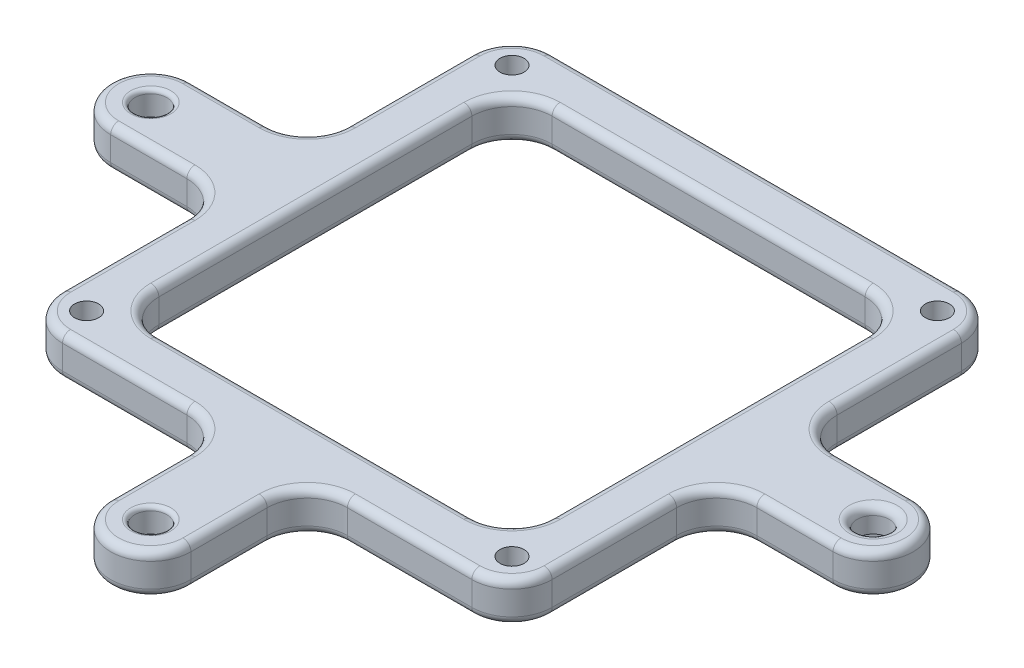
from build123d import *

# Parameters (mm, degrees)
SKETCH1_R           = 2
SKETCH1_R_2         = 1.5
SKETCH1_W           = 49
SKETCH1_H           = 49
BOSS_EXTRUDE1_DEPTH = 5
FILLET1_R           = 5
FILLET2_R           = 5
FILLET3_R           = 5
FILLET4_R           = 1
FILLET5_R           = 0.5
CUT_EXTRUDE1_DEPTH  = 2
FILLET6_R           = 1
CHAMFER2_SIZE       = 0.8


with BuildPart() as part:
    # Sketch1 → Boss-Extrude1 (new body)
    with BuildSketch(Plane(origin=(0, 0, 0), x_dir=(1, 0, 0), z_dir=(0, 1, 0))):
        with BuildLine():
            Line((-30.5, 5), (-45, 5))
            ThreePointArc((-45, 5), (-50, 0), (-45, -5))
            Line((-45, -5), (-30.5, -5))
            Line((-30.5, -5), (-30.5, -30.5))
            Line((-30.5, -30.5), (-5, -30.5))
            Line((-5, -30.5), (-5, -45))
            ThreePointArc((-5, -45), (0, -50), (5, -45))
            Line((5, -45), (5, -30.5))
            Line((5, -30.5), (30.5, -30.5))
            Line((30.5, -30.5), (30.5, -5))
            Line((30.5, -5), (45, -5))
            ThreePointArc((45, -5), (50, 0), (45, 5))
            Line((45, 5), (30.5, 5))
            Line((30.5, 5), (30.5, 30.5))
            Line((30.5, 30.5), (-30.5, 30.5))
            Line((-30.5, 30.5), (-30.5, 5))
        make_face()
        with Locations(Location((-45, 0, 0), (0, 0, 270))):
            Circle(SKETCH1_R, mode=Mode.SUBTRACT)
        with Locations(Location((45, 0, 0), (0, 0, 270))):
            Circle(SKETCH1_R, mode=Mode.SUBTRACT)
        with Locations(Location((0, -45, 0), (0, 0, 270))):
            Circle(SKETCH1_R, mode=Mode.SUBTRACT)
        with Locations(Location((26.5, 26.5, 0), (0, 0, 270))):
            Circle(SKETCH1_R_2, mode=Mode.SUBTRACT)
        with Locations(Location((-26.5, 26.5, 0), (0, 0, 270))):
            Circle(SKETCH1_R_2, mode=Mode.SUBTRACT)
        with Locations(Location((-26.5, -26.5, 0), (0, 0, 270))):
            Circle(SKETCH1_R_2, mode=Mode.SUBTRACT)
        with Locations(Location((26.5, -26.5, 0), (0, 0, 270))):
            Circle(SKETCH1_R_2, mode=Mode.SUBTRACT)
        Rectangle(SKETCH1_W, SKETCH1_H, mode=Mode.SUBTRACT)
    extrude(amount=BOSS_EXTRUDE1_DEPTH)

    # Fillet1
    fillet1_edges = [part.edges().sort_by_distance(p)[0] for p in [
        (24.5, 2.5, -24.5),
        (-24.5, 2.5, -24.5),
        (-24.5, 2.5, 24.5),
        (24.5, 2.5, 24.5),
    ]]
    fillet(fillet1_edges, radius=FILLET1_R)

    # Fillet2
    fillet2_edges = [part.edges().sort_by_distance(p)[0] for p in [
        (-30.5, 2.5, -30.5),
        (30.5, 2.5, -30.5),
        (30.5, 2.5, 30.5),
        (-30.5, 2.5, 30.5),
    ]]
    fillet(fillet2_edges, radius=FILLET2_R)

    # Fillet3
    fillet3_edges = [part.edges().sort_by_distance(p)[0] for p in [
        (-30.5, 2.5, -5),
        (30.5, 2.5, -5),
        (30.5, 2.5, 5),
        (5, 2.5, 30.5),
        (-5, 2.5, 30.5),
        (-30.5, 2.5, 5),
    ]]
    fillet(fillet3_edges, radius=FILLET3_R)

    # Fillet4
    fillet4_edges = [part.edges().sort_by_distance(p)[0] for p in [
        (45, 5, -2),
    ]]
    fillet(fillet4_edges, radius=FILLET4_R)

    # Fillet5
    fillet5_edges = [part.edges().sort_by_distance(p)[0] for p in [
        (-45, 5, -2),
        (0, 5, 43),
    ]]
    fillet(fillet5_edges, radius=FILLET5_R)

    # Sketch2 → Cut-Extrude1 (cut)
    with BuildSketch(Plane.XZ):
        Polygon((2.078460969, 48.6), (-2.078460969, 48.6), (-4.156921938, 45), (-2.078460969, 41.4), (2.078460969, 41.4), (4.156921938, 45), align=None)
        Polygon((-48.6, 2.078460969), (-48.6, -2.078460969), (-45, -4.156921938), (-41.4, -2.078460969), (-41.4, 2.078460969), (-45, 4.156921938), align=None)
        Polygon((45, 4.156921938), (48.6, 2.078460969), (48.6, -2.078460969), (45, -4.156921938), (41.4, -2.078460969), (41.4, 2.078460969), align=None)
    extrude(amount=-CUT_EXTRUDE1_DEPTH, mode=Mode.SUBTRACT)

    # Fillet6
    # the kernel refuses this fillet: 1 mm, written as the material it takes off along each edge
    with BuildSketch(Plane(origin=(45, 5, 0), x_dir=(0, 0, 1), z_dir=(-1, 0, 0))) as fillet6_piece_1:
        with BuildLine():
            CenterArc((5 - FILLET6_R, -FILLET6_R), FILLET6_R, 0, 90)
            Line((5, -FILLET6_R), (5, 0))
            Line((5, 0), (5 - FILLET6_R, 0))
        make_face()
    revolve(axis=Axis((45, 5, 0), (0, 1, 0)), revolution_arc=180, mode=Mode.SUBTRACT)
    with BuildSketch(Plane(origin=(30.5, 0, 25.5), x_dir=(0, 1, 0), z_dir=(0, 0, -1)), Plane(origin=(30.5, 5, 25.5), x_dir=(-1, 0, 0), z_dir=(0, 0, -1)), Plane(origin=(-25.5, 0, 30.5), x_dir=(0, 1, 0), z_dir=(1, 0, 0)), Plane(origin=(-30.5, 0, 10), x_dir=(0, 1, 0), z_dir=(0, 0, 1)), Plane(origin=(-30.5, 5, 10), x_dir=(1, 0, 0), z_dir=(0, 0, 1)), Plane(origin=(-25.5, 5, 30.5), x_dir=(0, 0, -1), z_dir=(1, 0, 0)), Plane(origin=(10, 0, 30.5), x_dir=(0, 1, 0), z_dir=(1, 0, 0)), Plane(origin=(10, 5, 30.5), x_dir=(0, 0, -1), z_dir=(1, 0, 0)), Plane(origin=(30.5, 0, -10), x_dir=(0, 1, 0), z_dir=(0, 0, -1)), Plane(origin=(30.5, 5, -10), x_dir=(-1, 0, 0), z_dir=(0, 0, -1)), Plane(origin=(-30.5, 5, -25.5), x_dir=(1, 0, 0), z_dir=(0, 0, 1)), Plane(origin=(-30.5, 0, -25.5), x_dir=(0, 1, 0), z_dir=(0, 0, 1))) as fillet6_piece_2:
        with BuildLine():
            CenterArc((FILLET6_R, -FILLET6_R), FILLET6_R, 90, 90)
            Line((0, -FILLET6_R), (0, 0))
            Line((0, 0), (FILLET6_R, 0))
        make_face()
    extrude(amount=15.5, mode=Mode.SUBTRACT)
    with BuildSketch(Plane(origin=(25.5, 0, -30.5), x_dir=(0, 1, 0), z_dir=(-1, 0, 0)), Plane(origin=(25.5, 5, -30.5), x_dir=(0, 0, 1), z_dir=(-1, 0, 0))) as fillet6_piece_3:
        with BuildLine():
            CenterArc((FILLET6_R, -FILLET6_R), FILLET6_R, 90, 90)
            Line((0, -FILLET6_R), (0, 0))
            Line((0, 0), (FILLET6_R, 0))
        make_face()
    extrude(amount=51, mode=Mode.SUBTRACT)
    with BuildSketch(Plane(origin=(-25.5, 0, 25.5), x_dir=(-1, 0, 0), z_dir=(0, 0, -1))) as fillet6_piece_4:
        with BuildLine():
            CenterArc((5 - FILLET6_R, FILLET6_R), FILLET6_R, 270, 90)
            Line((5 - FILLET6_R, 0), (5, 0))
            Line((5, 0), (5, FILLET6_R))
        make_face()
    revolve(axis=Axis((-25.5, 0, 25.5), (0, 1, 0)), revolution_arc=90, mode=Mode.SUBTRACT)
    with BuildSketch(Plane(origin=(-25.5, 0, -25.5), x_dir=(0, 0, -1), z_dir=(1, 0, 0))) as fillet6_piece_5:
        with BuildLine():
            CenterArc((5 - FILLET6_R, FILLET6_R), FILLET6_R, 270, 90)
            Line((5 - FILLET6_R, 0), (5, 0))
            Line((5, 0), (5, FILLET6_R))
        make_face()
    revolve(axis=Axis((-25.5, 0, -25.5), (0, 1, 0)), revolution_arc=90, mode=Mode.SUBTRACT)
    with BuildSketch(Plane(origin=(25.5, 0, -25.5), x_dir=(1, 0, 0), z_dir=(0, 0, 1))) as fillet6_piece_6:
        with BuildLine():
            CenterArc((5 - FILLET6_R, FILLET6_R), FILLET6_R, 270, 90)
            Line((5 - FILLET6_R, 0), (5, 0))
            Line((5, 0), (5, FILLET6_R))
        make_face()
    revolve(axis=Axis((25.5, 0, -25.5), (0, 1, 0)), revolution_arc=90, mode=Mode.SUBTRACT)
    with BuildSketch(Plane(origin=(25.5, 0, 25.5), x_dir=(0, 0, 1), z_dir=(-1, 0, 0))) as fillet6_piece_7:
        with BuildLine():
            CenterArc((5 - FILLET6_R, FILLET6_R), FILLET6_R, 270, 90)
            Line((5 - FILLET6_R, 0), (5, 0))
            Line((5, 0), (5, FILLET6_R))
        make_face()
    revolve(axis=Axis((25.5, 0, 25.5), (0, 1, 0)), revolution_arc=90, mode=Mode.SUBTRACT)
    with BuildSketch(Plane(origin=(-25.5, 5, 25.5), x_dir=(-1, 0, 0), z_dir=(0, 0, -1))) as fillet6_piece_8:
        with BuildLine():
            CenterArc((5 - FILLET6_R, -FILLET6_R), FILLET6_R, 0, 90)
            Line((5, -FILLET6_R), (5, 0))
            Line((5, 0), (5 - FILLET6_R, 0))
        make_face()
    revolve(axis=Axis((-25.5, 5, 25.5), (0, 1, 0)), revolution_arc=90, mode=Mode.SUBTRACT)
    with BuildSketch(Plane(origin=(-25.5, 5, -25.5), x_dir=(0, 0, -1), z_dir=(1, 0, 0))) as fillet6_piece_9:
        with BuildLine():
            CenterArc((5 - FILLET6_R, -FILLET6_R), FILLET6_R, 0, 90)
            Line((5, -FILLET6_R), (5, 0))
            Line((5, 0), (5 - FILLET6_R, 0))
        make_face()
    revolve(axis=Axis((-25.5, 5, -25.5), (0, 1, 0)), revolution_arc=90, mode=Mode.SUBTRACT)
    with BuildSketch(Plane(origin=(25.5, 5, -25.5), x_dir=(1, 0, 0), z_dir=(0, 0, 1))) as fillet6_piece_10:
        with BuildLine():
            CenterArc((5 - FILLET6_R, -FILLET6_R), FILLET6_R, 0, 90)
            Line((5, -FILLET6_R), (5, 0))
            Line((5, 0), (5 - FILLET6_R, 0))
        make_face()
    revolve(axis=Axis((25.5, 5, -25.5), (0, 1, 0)), revolution_arc=90, mode=Mode.SUBTRACT)
    with BuildSketch(Plane(origin=(25.5, 5, 25.5), x_dir=(0, 0, 1), z_dir=(-1, 0, 0))) as fillet6_piece_11:
        with BuildLine():
            CenterArc((5 - FILLET6_R, -FILLET6_R), FILLET6_R, 0, 90)
            Line((5, -FILLET6_R), (5, 0))
            Line((5, 0), (5 - FILLET6_R, 0))
        make_face()
    revolve(axis=Axis((25.5, 5, 25.5), (0, 1, 0)), revolution_arc=90, mode=Mode.SUBTRACT)
    with BuildSketch(Plane(origin=(35.5, 0, 5), x_dir=(0, 1, 0), z_dir=(1, 0, 0)), Plane(origin=(35.5, 5, 5), x_dir=(0, 0, -1), z_dir=(1, 0, 0)), Plane(origin=(45, 0, -5), x_dir=(0, 1, 0), z_dir=(-1, 0, 0)), Plane(origin=(45, 5, -5), x_dir=(0, 0, 1), z_dir=(-1, 0, 0)), Plane(origin=(-35.5, 0, -5), x_dir=(0, 1, 0), z_dir=(-1, 0, 0)), Plane(origin=(-35.5, 5, -5), x_dir=(0, 0, 1), z_dir=(-1, 0, 0)), Plane(origin=(-45, 0, 5), x_dir=(0, 1, 0), z_dir=(1, 0, 0)), Plane(origin=(-45, 5, 5), x_dir=(0, 0, -1), z_dir=(1, 0, 0)), Plane(origin=(5, 0, 45), x_dir=(0, 1, 0), z_dir=(0, 0, -1)), Plane(origin=(-5, 0, 35.5), x_dir=(0, 1, 0), z_dir=(0, 0, 1)), Plane(origin=(-5, 5, 35.5), x_dir=(1, 0, 0), z_dir=(0, 0, 1)), Plane(origin=(5, 5, 45), x_dir=(-1, 0, 0), z_dir=(0, 0, -1))) as fillet6_piece_12:
        with BuildLine():
            CenterArc((FILLET6_R, -FILLET6_R), FILLET6_R, 90, 90)
            Line((0, -FILLET6_R), (0, 0))
            Line((0, 0), (FILLET6_R, 0))
        make_face()
    extrude(amount=9.5, mode=Mode.SUBTRACT)
    with BuildSketch(Plane(origin=(-10, 0, 35.5), x_dir=(0, 0, -1), z_dir=(-1, 0, 0))) as fillet6_piece_13:
        with BuildLine():
            CenterArc((5 + FILLET6_R, -FILLET6_R), FILLET6_R, 90, 90)
            Line((5 + FILLET6_R, 0), (5, 0))
            Line((5, 0), (5, -FILLET6_R))
        make_face()
    revolve(axis=Axis((-10, 0, 35.5), (0, -1, 0)), revolution_arc=90, mode=Mode.SUBTRACT)
    with BuildSketch(Plane(origin=(-10, 5, 35.5), x_dir=(0, 0, -1), z_dir=(-1, 0, 0))) as fillet6_piece_14:
        with BuildLine():
            CenterArc((5 + FILLET6_R, FILLET6_R), FILLET6_R, 180, 90)
            Line((5, FILLET6_R), (5, 0))
            Line((5, 0), (5 + FILLET6_R, 0))
        make_face()
    revolve(axis=Axis((-10, 5, 35.5), (0, -1, 0)), revolution_arc=90, mode=Mode.SUBTRACT)
    with BuildSketch(Plane(origin=(10, 0, 35.5), x_dir=(-1, 0, 0), z_dir=(0, 0, 1))) as fillet6_piece_15:
        with BuildLine():
            CenterArc((5 + FILLET6_R, -FILLET6_R), FILLET6_R, 90, 90)
            Line((5 + FILLET6_R, 0), (5, 0))
            Line((5, 0), (5, -FILLET6_R))
        make_face()
    revolve(axis=Axis((10, 0, 35.5), (0, -1, 0)), revolution_arc=90, mode=Mode.SUBTRACT)
    with BuildSketch(Plane(origin=(10, 5, 35.5), x_dir=(-1, 0, 0), z_dir=(0, 0, 1))) as fillet6_piece_16:
        with BuildLine():
            CenterArc((5 + FILLET6_R, FILLET6_R), FILLET6_R, 180, 90)
            Line((5, FILLET6_R), (5, 0))
            Line((5, 0), (5 + FILLET6_R, 0))
        make_face()
    revolve(axis=Axis((10, 5, 35.5), (0, -1, 0)), revolution_arc=90, mode=Mode.SUBTRACT)
    with BuildSketch(Plane(origin=(35.5, 0, 10), x_dir=(-1, 0, 0), z_dir=(0, 0, 1))) as fillet6_piece_17:
        with BuildLine():
            CenterArc((5 + FILLET6_R, -FILLET6_R), FILLET6_R, 90, 90)
            Line((5 + FILLET6_R, 0), (5, 0))
            Line((5, 0), (5, -FILLET6_R))
        make_face()
    revolve(axis=Axis((35.5, 0, 10), (0, -1, 0)), revolution_arc=90, mode=Mode.SUBTRACT)
    with BuildSketch(Plane(origin=(35.5, 5, 10), x_dir=(-1, 0, 0), z_dir=(0, 0, 1))) as fillet6_piece_18:
        with BuildLine():
            CenterArc((5 + FILLET6_R, FILLET6_R), FILLET6_R, 180, 90)
            Line((5, FILLET6_R), (5, 0))
            Line((5, 0), (5 + FILLET6_R, 0))
        make_face()
    revolve(axis=Axis((35.5, 5, 10), (0, -1, 0)), revolution_arc=90, mode=Mode.SUBTRACT)
    with BuildSketch(Plane(origin=(35.5, 0, -10), x_dir=(-1, 0, 0), z_dir=(0, 0, -1))) as fillet6_piece_19:
        with BuildLine():
            CenterArc((5 + FILLET6_R, FILLET6_R), FILLET6_R, 180, 90)
            Line((5 + FILLET6_R, 0), (5, 0))
            Line((5, 0), (5, FILLET6_R))
        make_face()
    revolve(axis=Axis((35.5, 0, -10), (0, 1, 0)), revolution_arc=90, mode=Mode.SUBTRACT)
    with BuildSketch(Plane(origin=(35.5, 5, -10), x_dir=(-1, 0, 0), z_dir=(0, 0, -1))) as fillet6_piece_20:
        with BuildLine():
            CenterArc((5 + FILLET6_R, -FILLET6_R), FILLET6_R, 90, 90)
            Line((5, -FILLET6_R), (5, 0))
            Line((5, 0), (5 + FILLET6_R, 0))
        make_face()
    revolve(axis=Axis((35.5, 5, -10), (0, 1, 0)), revolution_arc=90, mode=Mode.SUBTRACT)
    with BuildSketch(Plane(origin=(-35.5, 0, -10), x_dir=(0, 0, 1), z_dir=(-1, 0, 0))) as fillet6_piece_21:
        with BuildLine():
            CenterArc((5 + FILLET6_R, FILLET6_R), FILLET6_R, 180, 90)
            Line((5 + FILLET6_R, 0), (5, 0))
            Line((5, 0), (5, FILLET6_R))
        make_face()
    revolve(axis=Axis((-35.5, 0, -10), (0, 1, 0)), revolution_arc=90, mode=Mode.SUBTRACT)
    with BuildSketch(Plane(origin=(-35.5, 5, -10), x_dir=(0, 0, 1), z_dir=(-1, 0, 0))) as fillet6_piece_22:
        with BuildLine():
            CenterArc((5 + FILLET6_R, -FILLET6_R), FILLET6_R, 90, 90)
            Line((5, -FILLET6_R), (5, 0))
            Line((5, 0), (5 + FILLET6_R, 0))
        make_face()
    revolve(axis=Axis((-35.5, 5, -10), (0, 1, 0)), revolution_arc=90, mode=Mode.SUBTRACT)
    with BuildSketch(Plane(origin=(-35.5, 0, 10), x_dir=(1, 0, 0), z_dir=(0, 0, 1))) as fillet6_piece_23:
        with BuildLine():
            CenterArc((5 + FILLET6_R, FILLET6_R), FILLET6_R, 180, 90)
            Line((5 + FILLET6_R, 0), (5, 0))
            Line((5, 0), (5, FILLET6_R))
        make_face()
    revolve(axis=Axis((-35.5, 0, 10), (0, 1, 0)), revolution_arc=90, mode=Mode.SUBTRACT)
    with BuildSketch(Plane(origin=(-35.5, 5, 10), x_dir=(1, 0, 0), z_dir=(0, 0, 1))) as fillet6_piece_24:
        with BuildLine():
            CenterArc((5 + FILLET6_R, -FILLET6_R), FILLET6_R, 90, 90)
            Line((5, -FILLET6_R), (5, 0))
            Line((5, 0), (5 + FILLET6_R, 0))
        make_face()
    revolve(axis=Axis((-35.5, 5, 10), (0, 1, 0)), revolution_arc=90, mode=Mode.SUBTRACT)
    with BuildSketch(Plane(origin=(45, 0, 0), x_dir=(0, 0, 1), z_dir=(-1, 0, 0))) as fillet6_piece_25:
        with BuildLine():
            CenterArc((5 - FILLET6_R, FILLET6_R), FILLET6_R, 270, 90)
            Line((5 - FILLET6_R, 0), (5, 0))
            Line((5, 0), (5, FILLET6_R))
        make_face()
    revolve(axis=Axis((45, 0, 0), (0, 1, 0)), revolution_arc=180, mode=Mode.SUBTRACT)
    with BuildSketch(Plane(origin=(0, 0, 45), x_dir=(-1, 0, 0), z_dir=(0, 0, -1))) as fillet6_piece_26:
        with BuildLine():
            CenterArc((5 - FILLET6_R, FILLET6_R), FILLET6_R, 270, 90)
            Line((5 - FILLET6_R, 0), (5, 0))
            Line((5, 0), (5, FILLET6_R))
        make_face()
    revolve(axis=Axis((0, 0, 45), (0, 1, 0)), revolution_arc=180, mode=Mode.SUBTRACT)
    with BuildSketch(Plane(origin=(-45, 0, 0), x_dir=(0, 0, -1), z_dir=(1, 0, 0))) as fillet6_piece_27:
        with BuildLine():
            CenterArc((5 - FILLET6_R, FILLET6_R), FILLET6_R, 270, 90)
            Line((5 - FILLET6_R, 0), (5, 0))
            Line((5, 0), (5, FILLET6_R))
        make_face()
    revolve(axis=Axis((-45, 0, 0), (0, 1, 0)), revolution_arc=180, mode=Mode.SUBTRACT)
    with BuildSketch(Plane(origin=(-45, 5, 0), x_dir=(0, 0, -1), z_dir=(1, 0, 0))) as fillet6_piece_28:
        with BuildLine():
            CenterArc((5 - FILLET6_R, -FILLET6_R), FILLET6_R, 0, 90)
            Line((5, -FILLET6_R), (5, 0))
            Line((5, 0), (5 - FILLET6_R, 0))
        make_face()
    revolve(axis=Axis((-45, 5, 0), (0, 1, 0)), revolution_arc=180, mode=Mode.SUBTRACT)
    with BuildSketch(Plane(origin=(24.5, 0, 19.5), x_dir=(0, 1, 0), z_dir=(0, 0, -1)), Plane(origin=(24.5, 5, 19.5), x_dir=(1, 0, 0), z_dir=(0, 0, -1)), Plane(origin=(19.5, 0, -24.5), x_dir=(0, 1, 0), z_dir=(-1, 0, 0)), Plane(origin=(19.5, 5, -24.5), x_dir=(0, 0, -1), z_dir=(-1, 0, 0)), Plane(origin=(-19.5, 0, 24.5), x_dir=(0, 1, 0), z_dir=(1, 0, 0)), Plane(origin=(-19.5, 5, 24.5), x_dir=(0, 0, 1), z_dir=(1, 0, 0)), Plane(origin=(-24.5, 0, -19.5), x_dir=(0, 1, 0), z_dir=(0, 0, 1)), Plane(origin=(-24.5, 5, -19.5), x_dir=(-1, 0, 0), z_dir=(0, 0, 1))) as fillet6_piece_29:
        with BuildLine():
            CenterArc((FILLET6_R, FILLET6_R), FILLET6_R, 180, 90)
            Line((0, FILLET6_R), (0, 0))
            Line((0, 0), (FILLET6_R, 0))
        make_face()
    extrude(amount=39, mode=Mode.SUBTRACT)
    with BuildSketch(Plane(origin=(0, 5, 45), x_dir=(-1, 0, 0), z_dir=(0, 0, -1))) as fillet6_piece_30:
        with BuildLine():
            CenterArc((5 - FILLET6_R, -FILLET6_R), FILLET6_R, 0, 90)
            Line((5, -FILLET6_R), (5, 0))
            Line((5, 0), (5 - FILLET6_R, 0))
        make_face()
    revolve(axis=Axis((0, 5, 45), (0, 1, 0)), revolution_arc=180, mode=Mode.SUBTRACT)
    with BuildSketch(Plane(origin=(19.5, 0, -19.5), x_dir=(0, 0, -1), z_dir=(-1, 0, 0))) as fillet6_piece_31:
        with BuildLine():
            CenterArc((5 + FILLET6_R, -FILLET6_R), FILLET6_R, 90, 90)
            Line((5 + FILLET6_R, 0), (5, 0))
            Line((5, 0), (5, -FILLET6_R))
        make_face()
    revolve(axis=Axis((19.5, 0, -19.5), (0, -1, 0)), revolution_arc=90, mode=Mode.SUBTRACT)
    with BuildSketch(Plane(origin=(19.5, 5, -19.5), x_dir=(0, 0, -1), z_dir=(-1, 0, 0))) as fillet6_piece_32:
        with BuildLine():
            CenterArc((5 + FILLET6_R, FILLET6_R), FILLET6_R, 180, 90)
            Line((5, FILLET6_R), (5, 0))
            Line((5, 0), (5 + FILLET6_R, 0))
        make_face()
    revolve(axis=Axis((19.5, 5, -19.5), (0, -1, 0)), revolution_arc=90, mode=Mode.SUBTRACT)
    with BuildSketch(Plane(origin=(19.5, 0, 19.5), x_dir=(0, 0, 1), z_dir=(-1, 0, 0))) as fillet6_piece_33:
        with BuildLine():
            CenterArc((5 + FILLET6_R, FILLET6_R), FILLET6_R, 180, 90)
            Line((5 + FILLET6_R, 0), (5, 0))
            Line((5, 0), (5, FILLET6_R))
        make_face()
    revolve(axis=Axis((19.5, 0, 19.5), (0, 1, 0)), revolution_arc=90, mode=Mode.SUBTRACT)
    with BuildSketch(Plane(origin=(19.5, 5, 19.5), x_dir=(0, 0, 1), z_dir=(-1, 0, 0))) as fillet6_piece_34:
        with BuildLine():
            CenterArc((5 + FILLET6_R, -FILLET6_R), FILLET6_R, 90, 90)
            Line((5, -FILLET6_R), (5, 0))
            Line((5, 0), (5 + FILLET6_R, 0))
        make_face()
    revolve(axis=Axis((19.5, 5, 19.5), (0, 1, 0)), revolution_arc=90, mode=Mode.SUBTRACT)
    with BuildSketch(Plane(origin=(-19.5, 0, 19.5), x_dir=(0, 0, 1), z_dir=(1, 0, 0))) as fillet6_piece_35:
        with BuildLine():
            CenterArc((5 + FILLET6_R, -FILLET6_R), FILLET6_R, 90, 90)
            Line((5 + FILLET6_R, 0), (5, 0))
            Line((5, 0), (5, -FILLET6_R))
        make_face()
    revolve(axis=Axis((-19.5, 0, 19.5), (0, -1, 0)), revolution_arc=90, mode=Mode.SUBTRACT)
    with BuildSketch(Plane(origin=(-19.5, 5, 19.5), x_dir=(0, 0, 1), z_dir=(1, 0, 0))) as fillet6_piece_36:
        with BuildLine():
            CenterArc((5 + FILLET6_R, FILLET6_R), FILLET6_R, 180, 90)
            Line((5, FILLET6_R), (5, 0))
            Line((5, 0), (5 + FILLET6_R, 0))
        make_face()
    revolve(axis=Axis((-19.5, 5, 19.5), (0, -1, 0)), revolution_arc=90, mode=Mode.SUBTRACT)
    with BuildSketch(Plane(origin=(-19.5, 0, -19.5), x_dir=(-1, 0, 0), z_dir=(0, 0, 1))) as fillet6_piece_37:
        with BuildLine():
            CenterArc((5 + FILLET6_R, -FILLET6_R), FILLET6_R, 90, 90)
            Line((5 + FILLET6_R, 0), (5, 0))
            Line((5, 0), (5, -FILLET6_R))
        make_face()
    revolve(axis=Axis((-19.5, 0, -19.5), (0, -1, 0)), revolution_arc=90, mode=Mode.SUBTRACT)
    with BuildSketch(Plane(origin=(-19.5, 5, -19.5), x_dir=(-1, 0, 0), z_dir=(0, 0, 1))) as fillet6_piece_38:
        with BuildLine():
            CenterArc((5 + FILLET6_R, FILLET6_R), FILLET6_R, 180, 90)
            Line((5, FILLET6_R), (5, 0))
            Line((5, 0), (5 + FILLET6_R, 0))
        make_face()
    revolve(axis=Axis((-19.5, 5, -19.5), (0, -1, 0)), revolution_arc=90, mode=Mode.SUBTRACT)

    # Chamfer2
    chamfer2_edges = [part.edges().sort_by_distance(p)[0] for p in [
        (26.5, 0, 25),
        (-26.5, 0, 25),
        (-26.5, 0, -28),
        (26.5, 0, -28),
    ]]
    chamfer(chamfer2_edges, length=CHAMFER2_SIZE)


solid = part.part
